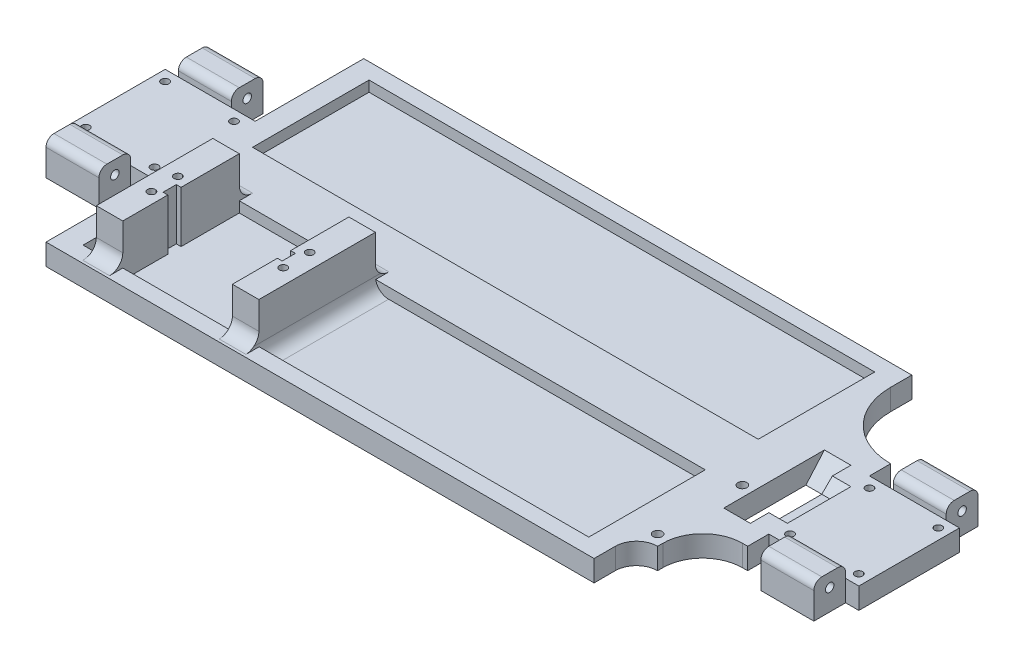
from build123d import *

# Parameters (mm, degrees)
SKETCH1_W            = 300
SKETCH1_H            = 20
BOSS_EXTRUDE1_DEPTH  = 8
SKETCH2_W            = 34
SKETCH2_H            = 8
BOSS_EXTRUDE2_DEPTH  = 9
SKETCH3_W            = 34
SKETCH3_H            = 8
BOSS_EXTRUDE3_DEPTH  = 9
SKETCH4_R            = 1.45
CUT_EXTRUDE1_DEPTH   = 302.504560496
SKETCH5_W            = 25
SKETCH5_H            = 8
BOSS_EXTRUDE4_DEPTH  = 17
SKETCH6_W            = 25
SKETCH6_H            = 8
BOSS_EXTRUDE5_DEPTH  = 17
SKETCH7_W            = 10
SKETCH7_H            = 38
CUT_EXTRUDE2_DEPTH   = 303.37890138
SKETCH8_W            = 7
SKETCH8_H            = 16
CUT_EXTRUDE3_DEPTH   = 4
CUT_EXTRUDE4_DEPTH   = 7
BOSS_EXTRUDE6_DEPTH  = 10
SKETCH12_W           = 8
SKETCH12_H           = 8
BOSS_EXTRUDE7_DEPTH  = 17
SKETCH13_R           = 1.7
CUT_EXTRUDE6_DEPTH   = 305.926220585
SKETCH14_W           = 20
SKETCH14_H           = 13
BOSS_EXTRUDE8_DEPTH  = 12
SKETCH15_R           = 1.6
CUT_EXTRUDE7_DEPTH   = 20
SKETCH16_W           = 20
SKETCH16_H           = 13
BOSS_EXTRUDE9_DEPTH  = 12
SKETCH17_R           = 1.6
CUT_EXTRUDE8_DEPTH   = 20
SKETCH18_W           = 20
SKETCH18_H           = 13
BOSS_EXTRUDE10_DEPTH = 12
CUT_EXTRUDE9_START   = -20
SKETCH19_R           = 1.6
CUT_EXTRUDE9_DEPTH   = 20
SKETCH20_W           = 20
SKETCH20_H           = 13
BOSS_EXTRUDE11_DEPTH = 12
CUT_EXTRUDE10_START  = -20
SKETCH21_R           = 1.6
CUT_EXTRUDE10_DEPTH  = 20
SKETCH22_W           = 207
SKETCH22_H           = 50
BOSS_EXTRUDE12_DEPTH = 8
SKETCH23_W           = 191
SKETCH23_H           = 44
CUT_EXTRUDE11_DEPTH  = 4
SKETCH24_W           = 10
SKETCH24_H           = 44
BOSS_EXTRUDE14_DEPTH = 19.4
SKETCH25_R           = 1.45
CUT_EXTRUDE12_DEPTH  = 15
FILLET1_R            = 5
FILLET2_R            = 5
FILLET3_R            = 8
FILLET4_R            = 15
FILLET5_R            = 25
FILLET6_R            = 3
SKETCH27_W           = 1.8
SKETCH27_H           = 5
CUT_EXTRUDE13_DEPTH  = 19.4


with BuildPart() as part:
    # Sketch1 → Boss-Extrude1 (new body)
    with BuildSketch(Plane(origin=(0, 0, 0), x_dir=(1, 0, 0), z_dir=(0, 1, 0))):
        with Locations((150, -10)):
            Rectangle(SKETCH1_W, SKETCH1_H)
    extrude(amount=BOSS_EXTRUDE1_DEPTH)

    # Sketch2 → Boss-Extrude2 (add)
    with BuildSketch(Plane.XY.offset(20)):
        with Locations((17, 4)):
            Rectangle(SKETCH2_W, SKETCH2_H)
        with Locations((283, 4)):
            Rectangle(SKETCH2_W, SKETCH2_H)
    extrude(amount=BOSS_EXTRUDE2_DEPTH)

    # Sketch3 → Boss-Extrude3 (add)
    with BuildSketch(Plane(origin=(0, 0, 0), x_dir=(-1, 0, 0), z_dir=(0, 0, -1))):
        with Locations((-17, 4)):
            Rectangle(SKETCH3_W, SKETCH3_H)
        with Locations((-283, 4)):
            Rectangle(SKETCH3_W, SKETCH3_H)
    extrude(amount=BOSS_EXTRUDE3_DEPTH)

    # Sketch4 → Cut-Extrude1 (cut, through all)
    with BuildSketch(Plane(origin=(0, 8, 0), x_dir=(1, 0, 0), z_dir=(0, 1, 0))):
        with Locations(Location((4, 5, 0), (0, 0, 270))):
            Circle(SKETCH4_R)
        with Locations(Location((30, 5, 0), (0, 0, 270))):
            Circle(SKETCH4_R)
        with Locations(Location((30, -25, 0), (0, 0, 270))):
            Circle(SKETCH4_R)
        with Locations(Location((4, -25, 0), (0, 0, 270))):
            Circle(SKETCH4_R)
        with Locations(Location((296, -25, 0), (0, 0, 270))):
            Circle(SKETCH4_R)
        with Locations(Location((296, 5, 0), (0, 0, 270))):
            Circle(SKETCH4_R)
        with Locations(Location((270, -25, 0), (0, 0, 270))):
            Circle(SKETCH4_R)
        with Locations(Location((270, 5, 0), (0, 0, 270))):
            Circle(SKETCH4_R)
    extrude(amount=-CUT_EXTRUDE1_DEPTH, mode=Mode.SUBTRACT)

    # Sketch5 → Boss-Extrude4 (add)
    with BuildSketch(Plane.XY.offset(20)):
        with Locations((253.5, 4)):
            Rectangle(SKETCH5_W, SKETCH5_H)
    extrude(amount=BOSS_EXTRUDE4_DEPTH)

    # Sketch6 → Boss-Extrude5 (add)
    with BuildSketch(Plane(origin=(0, 0, 0), x_dir=(-1, 0, 0), z_dir=(0, 0, -1))):
        with Locations((-253.5, 4)):
            Rectangle(SKETCH6_W, SKETCH6_H)
    extrude(amount=BOSS_EXTRUDE5_DEPTH)

    # Sketch7 → Cut-Extrude2 (cut, through all)
    with BuildSketch(Plane(origin=(0, 8, 0), x_dir=(1, 0, 0), z_dir=(0, 1, 0))):
        with Locations((254, -10)):
            Rectangle(SKETCH7_W, SKETCH7_H)
    extrude(amount=-CUT_EXTRUDE2_DEPTH, mode=Mode.SUBTRACT)

    # Sketch8 → Cut-Extrude3 (cut)
    with BuildSketch(Plane(origin=(0, 8, 0), x_dir=(1, 0, 0), z_dir=(0, 1, 0))):
        with Locations((262.5, -10)):
            Rectangle(SKETCH8_W, SKETCH8_H)
    extrude(amount=-CUT_EXTRUDE3_DEPTH, mode=Mode.SUBTRACT)

    # Sketch9 → Cut-Extrude4 (cut)
    with BuildSketch(Plane.ZY.offset(-259)):
        Polygon((18, 4), (22, 8), (18, 8), align=None)
        Polygon((2, 4), (-2, 8), (2, 8), align=None)
    extrude(amount=-CUT_EXTRUDE4_DEPTH, mode=Mode.SUBTRACT)

    # Sketch10 → Boss-Extrude6 (add)
    with BuildSketch(Plane.ZY.offset(-259)):
        Polygon((-2, 0), (-9, 8), (-9, 0), align=None)
        Polygon((29, 8), (22, 0), (29, 0), align=None)
    extrude(amount=BOSS_EXTRUDE6_DEPTH)

    # Sketch12 → Boss-Extrude7 (add)
    with BuildSketch(Plane.XY.offset(37)):
        with Locations((245, 4)):
            Rectangle(SKETCH12_W, SKETCH12_H)
    extrude(amount=BOSS_EXTRUDE7_DEPTH)

    # Sketch13 → Cut-Extrude6 (cut, through all)
    with BuildSketch(Plane(origin=(0, 8, 0), x_dir=(1, 0, 0), z_dir=(0, 1, 0))):
        with Locations(Location((245, -50, 0), (0, 0, 270))):
            Circle(SKETCH13_R)
        with Locations(Location((245, -18, 0), (0, 0, 270))):
            Circle(SKETCH13_R)
    extrude(amount=-CUT_EXTRUDE6_DEPTH, mode=Mode.SUBTRACT)

    # Sketch14 → Boss-Extrude8 (add)
    with BuildSketch(Plane.XY.offset(29)):
        with Locations((285, 6.5)):
            Rectangle(SKETCH14_W, SKETCH14_H)
    extrude(amount=BOSS_EXTRUDE8_DEPTH)

    # Sketch15 → Cut-Extrude7 (cut)
    with BuildSketch(Plane(origin=(295, 0, 0), x_dir=(0, 0, -1), z_dir=(1, 0, 0))):
        with Locations((-35, 8)):
            Circle(SKETCH15_R)
    extrude(amount=-CUT_EXTRUDE7_DEPTH, mode=Mode.SUBTRACT)

    # Sketch16 → Boss-Extrude9 (add)
    with BuildSketch(Plane(origin=(0, 0, -9), x_dir=(-1, 0, 0), z_dir=(0, 0, -1))):
        with Locations((-285, 6.5)):
            Rectangle(SKETCH16_W, SKETCH16_H)
    extrude(amount=BOSS_EXTRUDE9_DEPTH)

    # Sketch17 → Cut-Extrude8 (cut)
    with BuildSketch(Plane(origin=(295, 0, 0), x_dir=(0, 0, -1), z_dir=(1, 0, 0))):
        with Locations((15, 8)):
            Circle(SKETCH17_R)
    extrude(amount=-CUT_EXTRUDE8_DEPTH, mode=Mode.SUBTRACT)

    # Sketch18 → Boss-Extrude10 (add)
    with BuildSketch(Plane(origin=(0, 0, -9), x_dir=(-1, 0, 0), z_dir=(0, 0, -1))):
        with Locations((-15, 6.5)):
            Rectangle(SKETCH18_W, SKETCH18_H)
    extrude(amount=BOSS_EXTRUDE10_DEPTH)

    # Sketch19 → Cut-Extrude9 (cut)
    with BuildSketch(Plane.ZY.offset(-5).offset(CUT_EXTRUDE9_START)):
        with Locations(Location((-15, 8, 0), (0, 0, 180))):
            Circle(SKETCH19_R)
    extrude(amount=CUT_EXTRUDE9_DEPTH, mode=Mode.SUBTRACT)

    # Sketch20 → Boss-Extrude11 (add)
    with BuildSketch(Plane.XY.offset(29)):
        with Locations((15, 6.5)):
            Rectangle(SKETCH20_W, SKETCH20_H)
    extrude(amount=BOSS_EXTRUDE11_DEPTH)

    # Sketch21 → Cut-Extrude10 (cut)
    with BuildSketch(Plane.ZY.offset(-5).offset(CUT_EXTRUDE10_START)):
        with Locations(Location((35, 8, 0), (0, 0, 180))):
            Circle(SKETCH21_R)
    extrude(amount=CUT_EXTRUDE10_DEPTH, mode=Mode.SUBTRACT)

    # Sketch22 → Boss-Extrude12 (add)
    with BuildSketch(Plane(origin=(0, 0, 0), x_dir=(-1, 0, 0), z_dir=(0, -1, 0))):
        with Locations((-137.5, -45)):
            Rectangle(SKETCH22_W, SKETCH22_H)
        with Locations((-137.5, 25)):
            Rectangle(SKETCH22_W, SKETCH22_H)
    extrude(amount=-BOSS_EXTRUDE12_DEPTH)

    # Sketch23 → Cut-Extrude11 (cut)
    with BuildSketch(Plane(origin=(0, 8, 0), x_dir=(1, 0, 0), z_dir=(0, 1, 0))):
        with Locations((137.5, -42)):
            Rectangle(SKETCH23_W, SKETCH23_H)
        with Locations((137.5, 22)):
            Rectangle(SKETCH23_W, SKETCH23_H)
    extrude(amount=-CUT_EXTRUDE11_DEPTH, mode=Mode.SUBTRACT)

    # Sketch24 → Boss-Extrude14 (add)
    with BuildSketch(Plane(origin=(0, 4, 0), x_dir=(1, 0, 0), z_dir=(0, 1, 0))):
        with Locations((103.4, -42)):
            Rectangle(SKETCH24_W, SKETCH24_H)
        with Locations((52, -42)):
            Rectangle(SKETCH24_W, SKETCH24_H)
    extrude(amount=BOSS_EXTRUDE14_DEPTH)

    # Sketch25 → Cut-Extrude12 (cut)
    with BuildSketch(Plane(origin=(0, 23.4, 0), x_dir=(1, 0, 0), z_dir=(0, 1, 0))):
        with Locations(Location((102.6, -49, 0), (0, 0, 270))):
            Circle(SKETCH25_R)
        with Locations(Location((102.6, -39, 0), (0, 0, 270))):
            Circle(SKETCH25_R)
        with Locations(Location((52.8, -49, 0), (0, 0, 270))):
            Circle(SKETCH25_R)
        with Locations(Location((52.8, -39, 0), (0, 0, 270))):
            Circle(SKETCH25_R)
    extrude(amount=-CUT_EXTRUDE12_DEPTH, mode=Mode.SUBTRACT)

    # Fillet1
    fillet1_edges = [part.edges().sort_by_distance(p)[0] for p in [
        (103.4, 8, 64),
        (103.4, 8, 20),
        (52, 8, 64),
        (52, 8, 20),
    ]]
    fillet(fillet1_edges, radius=FILLET1_R)

    # Fillet2
    fillet2_edges = [part.edges().sort_by_distance(p)[0] for p in [
        (47, 4, 42),
        (108.4, 4, 42),
    ]]
    fillet(fillet2_edges, radius=FILLET2_R - 0.0001)  # a hair under: the kernel refuses the full size

    # Fillet3
    fillet3_edges = [part.edges().sort_by_distance(p)[0] for p in [
        (241, 4, 54),
    ]]
    fillet(fillet3_edges, radius=FILLET3_R - 0.0001)  # a hair under: the kernel refuses the full size

    # Fillet4
    fillet4_edges = [part.edges().sort_by_distance(p)[0] for p in [
        (249, 4, 37),
    ]]
    fillet(fillet4_edges, radius=FILLET4_R)

    # Fillet5
    fillet5_edges = [part.edges().sort_by_distance(p)[0] for p in [
        (241, 4, -17),
    ]]
    fillet(fillet5_edges, radius=FILLET5_R - 0.0001)  # a hair under: the kernel refuses the full size

    # Fillet6
    fillet6_edges = [part.edges().sort_by_distance(p)[0] for p in [
        (285, 13, 29),
        (285, 13, 41),
        (285, 13, -9),
        (285, 13, -21),
        (15, 13, -9),
        (15, 13, -21),
        (15, 13, 29),
        (15, 13, 41),
    ]]
    fillet(fillet6_edges, radius=FILLET6_R)

    # Sketch27 → Cut-Extrude13 (cut)
    with BuildSketch(Plane(origin=(0, 23.4, 0), x_dir=(1, 0, 0), z_dir=(0, 1, 0))):
        with Locations((56.1, -44.5)):
            Rectangle(SKETCH27_W, SKETCH27_H)
        with Locations((99.3, -44.5)):
            Rectangle(SKETCH27_W, SKETCH27_H)
    extrude(amount=-CUT_EXTRUDE13_DEPTH, mode=Mode.SUBTRACT)


solid = part.part
